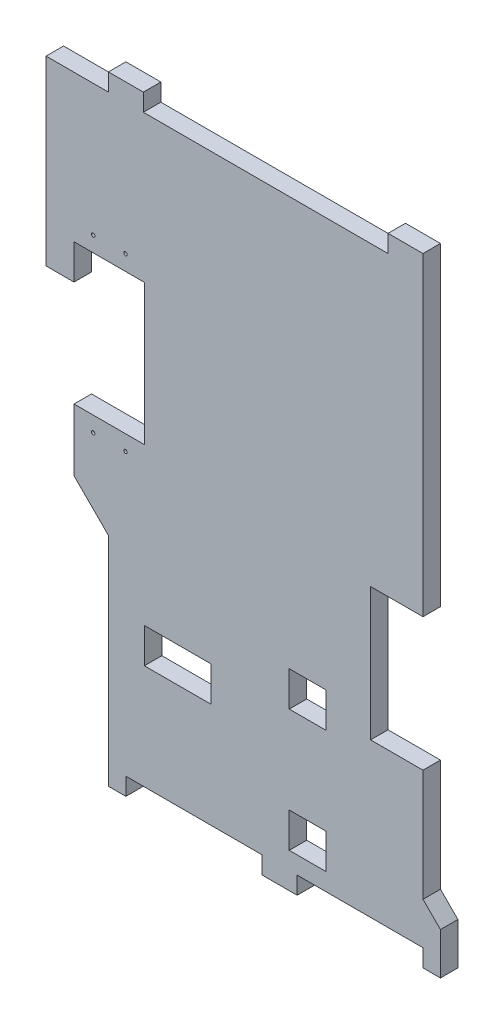
from build123d import *

# Parameters (mm, degrees)
ESQUISSE1_W             = 10.465871206
ESQUISSE1_H             = 10
ESQUISSE1_W_2           = 19.015615649
BOSS_EXTRU_1_DEPTH      = 5
BOSS_EXTRU_2_DEPTH      = 5
ESQUISSE3_R             = 0.5
ESQUISSE3_W             = 20.2
ESQUISSE3_H             = 40.2
ENL_V_MAT_EXTRU_1_DEPTH = 5
ESQUISSE4_W             = 10
ESQUISSE4_H             = 5
BOSS_EXTRU_3_DEPTH      = 5


with BuildPart() as part:
    # Esquisse1 → Boss.-Extru.1 (new body)
    with BuildSketch(Plane.XY):
        Polygon((90, 82), (90, 167), (90, 172), (80, 172), (80, 167), (10, 167), (10, 172), (0, 172), (0, 167), (0, 0), (0, -5), (5, -5), (5, 0), (90, 0), (90, 44), (75, 44), (75, 82), align=None)
        with Locations((56.967345119, 45)):
            Rectangle(ESQUISSE1_W, ESQUISSE1_H, mode=Mode.SUBTRACT)
        with Locations((56.967345119, 10)):
            Rectangle(ESQUISSE1_W, ESQUISSE1_H, mode=Mode.SUBTRACT)
        with Locations((19.799482129, 35)):
            Rectangle(ESQUISSE1_W_2, ESQUISSE1_H, mode=Mode.SUBTRACT)
    extrude(amount=BOSS_EXTRU_1_DEPTH)

    # Esquisse2 → Boss.-Extru.2 (add)
    with BuildSketch(Plane.XY.offset(5)):
        Polygon((0, 167), (-9.834708684, 167), (-9.834708684, 67), (0, 57.165291316), align=None)
    extrude(amount=-BOSS_EXTRU_2_DEPTH)

    # Esquisse3 → Enlèv. mat.-Extru.1 (cut)
    with BuildSketch(Plane(origin=(0, 0, 0), x_dir=(-1, 0, 0), z_dir=(0, 0, -1))):
        with Locations((4.359708684, 129.4)):
            Circle(ESQUISSE3_R)
        with Locations((-4.890291316, 129.4)):
            Circle(ESQUISSE3_R)
        with Locations((4.359708684, 80.4)):
            Circle(ESQUISSE3_R)
        with Locations((-4.890291316, 80.4)):
            Circle(ESQUISSE3_R)
        with Locations((-0.265291316, 104.9)):
            Rectangle(ESQUISSE3_W, ESQUISSE3_H)
    extrude(amount=-ENL_V_MAT_EXTRU_1_DEPTH, mode=Mode.SUBTRACT)

    # Esquisse4 → Boss.-Extru.3 (add)
    with BuildSketch(Plane.XY.offset(5)):
        Polygon((-9.834708684, 167), (-17.834708684, 167), (-17.834708684, 115), (-9.834708684, 115), (-9.834708684, 125), align=None)
        with Locations((49, -2.5)):
            Rectangle(ESQUISSE4_W, ESQUISSE4_H)
        Polygon((90, 12), (95, 7), (95, -5), (90, -5), align=None)
    extrude(amount=-BOSS_EXTRU_3_DEPTH)


solid = part.part
